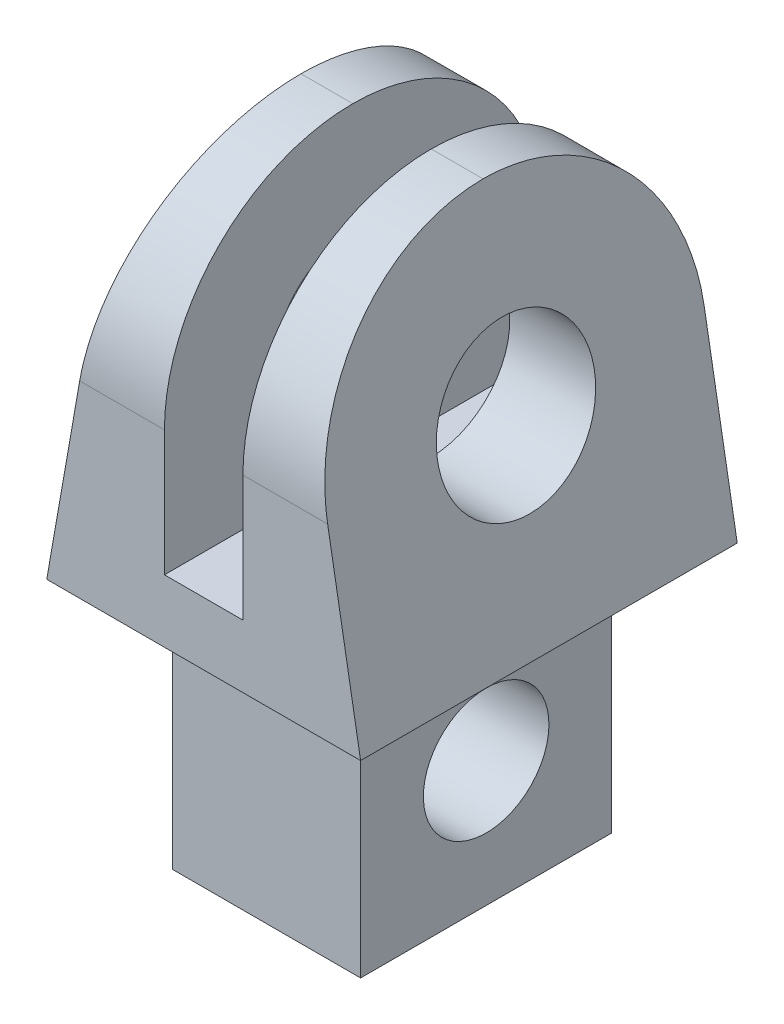
from build123d import *

# Parameters (mm, degrees)
SKETCH1_W           = 80
SKETCH1_H           = 60
BOSS_EXTRUDE1_DEPTH = 40
BOSS_EXTRUDE2_DEPTH = 60
SKETCH2_R           = 25
CUT_EXTRUDE2_DEPTH  = 60
FILLET1_R           = 60
SKETCH3_R           = 20
CUT_EXTRUDE3_DEPTH  = 60


with BuildPart() as part:
    # Sketch1 → Boss-Extrude1 (new, symmetric)
    with BuildSketch(Plane(origin=(0, 0, 0), x_dir=(0, 1, 0), z_dir=(0, 0, 1))):
        with Locations((-60, 0)):
            Rectangle(SKETCH1_W, SKETCH1_H)
    extrude(amount=BOSS_EXTRUDE1_DEPTH, both=True)

    # Sketch1<3> → Boss-Extrude2 (add, symmetric)
    with BuildSketch(Plane(origin=(0, 0, 0), x_dir=(0, 1, 0), z_dir=(0, 0, 1))):
        Polygon((100, -29), (-20, -50), (-20, 50), (100, 29), (100, 12.5), (0, 12.5), (0, -12.5), (100, -12.5), align=None)
    extrude(amount=BOSS_EXTRUDE2_DEPTH, both=True)

    # Sketch2 → Cut-Extrude2 (cut, symmetric)
    with BuildSketch(Plane.YZ):
        with Locations((40, 0)):
            Circle(SKETCH2_R)
    extrude(amount=CUT_EXTRUDE2_DEPTH, both=True, mode=Mode.SUBTRACT)

    # Fillet1
    fillet1_edges = [part.edges().sort_by_distance(p)[0] for p in [
        (-20.75, 100, -60),
        (20.75, 100, -60),
        (-20.75, 100, 60),
        (20.75, 100, 60),
    ]]
    fillet(fillet1_edges, radius=FILLET1_R - 0.0001)  # a hair under: the kernel refuses the full size

    # Sketch3 → Cut-Extrude3 (cut, symmetric)
    with BuildSketch(Plane.YZ.offset(30)):
        with Locations((-60, 0)):
            Circle(SKETCH3_R)
    extrude(amount=CUT_EXTRUDE3_DEPTH, both=True, mode=Mode.SUBTRACT)


solid = part.part
